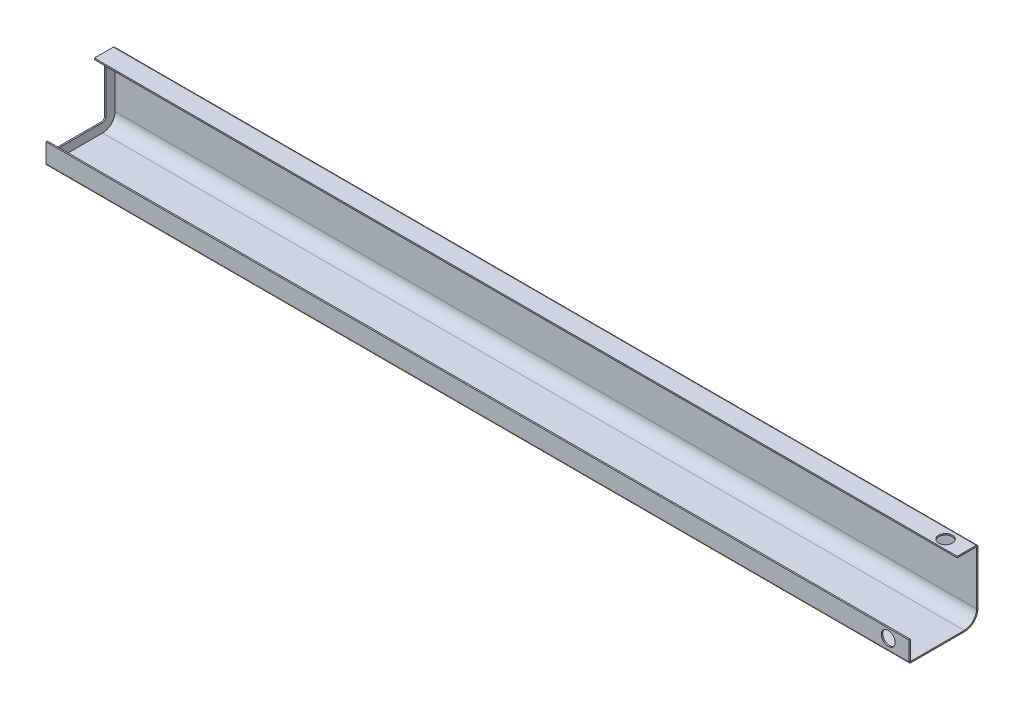
from build123d import *

# Parameters (mm, degrees)
SKETCH_2_W                       = 1250
SKETCH_2_H                       = 100
SM_BASE_FLANGE_1_DEPTH           = 2
SM_EDGE_FLANGE_1_STRIP_W         = 44
SM_EDGE_FLANGE_1_STRIP_H         = 2
SM_EDGE_FLANGE_1_STRIP_CUT_DEPTH = 1250
SM_EDGE_FLANGE_1_DEPTH           = 1250
SM_EDGE_FLANGE_2_STRIP_W         = 9.4732
SM_EDGE_FLANGE_2_STRIP_H         = 2
SM_EDGE_FLANGE_2_STRIP_CUT_DEPTH = 1250
SM_EDGE_FLANGE_2_DEPTH           = 1250
SM_EDGE_FLANGE_3_STRIP_W         = 9.4732
SM_EDGE_FLANGE_3_STRIP_H         = 2
SM_EDGE_FLANGE_3_STRIP_CUT_DEPTH = 1250
SM_EDGE_FLANGE_3_DEPTH           = 1250
SKETCH_16_R                      = 10
CUT_EXTRUDE_1_DEPTH              = 10
SKETCH_17_R                      = 10
CUT_EXTRUDE_2_DEPTH              = 10
EXTRUDE_1_DEPTH                  = 2


# Sheet-metal steps are written as plain solids
with BuildPart() as part:
    # Sketch 2 → 基体-法兰1 (new body)
    with BuildSketch(Plane.XY):
        Rectangle(SKETCH_2_W, SKETCH_2_H)
    extrude(amount=-SM_BASE_FLANGE_1_DEPTH)

    # 边线-法兰1 strip (across the edge) → 边线-法兰1 strip cut (cut)
    with BuildSketch(Plane(origin=(-625, -50, 0), x_dir=(0, 1, 0), z_dir=(1, 0, 0))):
        with Locations((-2, -1)):
            Rectangle(SM_EDGE_FLANGE_1_STRIP_W, SM_EDGE_FLANGE_1_STRIP_H)
    extrude(amount=SM_EDGE_FLANGE_1_STRIP_CUT_DEPTH, mode=Mode.SUBTRACT)

    # 边线-法兰1 section (across the edge) → 边线-法兰1 (add)
    with BuildSketch(Plane(origin=(-625, -50, 0), x_dir=(0, 1, 0), z_dir=(1, 0, 0))):
        with BuildLine():
            Line((0, 18), (0, 98))
            Line((0, 98), (2, 98))
            Line((2, 98), (2, 18))
            ThreePointArc((2, 18), (7.272077939, 5.272077939), (20, 0))
            Line((20, 0), (20, -2))
            ThreePointArc((20, -2), (5.857864376, 3.857864376), (0, 18))
        make_face()
    extrude(amount=SM_EDGE_FLANGE_1_DEPTH)

    # 边线-法兰2 strip (across the edge) → 边线-法兰2 strip cut (cut)
    with BuildSketch(Plane(origin=(625, 50, 0), x_dir=(0, -1, 0), z_dir=(-1, 0, 0))):
        with Locations((-2, -1)):
            Rectangle(SM_EDGE_FLANGE_2_STRIP_W, SM_EDGE_FLANGE_2_STRIP_H)
    extrude(amount=SM_EDGE_FLANGE_2_STRIP_CUT_DEPTH, mode=Mode.SUBTRACT)

    # 边线-法兰2 section (across the edge) → 边线-法兰2 (add)
    with BuildSketch(Plane(origin=(625, 50, 0), x_dir=(0, -1, 0), z_dir=(-1, 0, 0))):
        with BuildLine():
            Line((0, 0.7366), (0, 28))
            Line((0, 28), (2, 28))
            Line((2, 28), (2, 0.7366))
            ThreePointArc((2, 0.7366), (2.215745145, 0.215745145), (2.7366, 0))
            Line((2.7366, 0), (2.7366, -2))
            ThreePointArc((2.7366, -2), (0.801531583, -1.198468417), (0, 0.7366))
        make_face()
    extrude(amount=SM_EDGE_FLANGE_2_DEPTH)

    # 边线-法兰3 strip (across the edge) → 边线-法兰3 strip cut (cut)
    with BuildSketch(Plane(origin=(-625, -48, 98), x_dir=(0, 0, -1), z_dir=(1, 0, 0))):
        with Locations((-2, -1)):
            Rectangle(SM_EDGE_FLANGE_3_STRIP_W, SM_EDGE_FLANGE_3_STRIP_H)
    extrude(amount=SM_EDGE_FLANGE_3_STRIP_CUT_DEPTH, mode=Mode.SUBTRACT)

    # 边线-法兰3 section (across the edge) → 边线-法兰3 (add)
    with BuildSketch(Plane(origin=(-625, -48, 98), x_dir=(0, 0, -1), z_dir=(1, 0, 0))):
        with BuildLine():
            Line((0, 0.7366), (0, 28))
            Line((0, 28), (2, 28))
            Line((2, 28), (2, 0.7366))
            ThreePointArc((2, 0.7366), (2.215745145, 0.215745145), (2.7366, 0))
            Line((2.7366, 0), (2.7366, -2))
            ThreePointArc((2.7366, -2), (0.801531583, -1.198468417), (0, 0.7366))
        make_face()
    extrude(amount=SM_EDGE_FLANGE_3_DEPTH)

    # 草图16 → 切除-拉伸1 (cut)
    with BuildSketch(Plane(origin=(0, 50, 0), x_dir=(1, 0, 0), z_dir=(0, 1, 0))):
        with Locations(Location((595, -15, 0), (0, 0, 270))):
            Circle(SKETCH_16_R)
    extrude(amount=-CUT_EXTRUDE_1_DEPTH, mode=Mode.SUBTRACT)

    # 草图17 → 切除-拉伸2 (cut)
    with BuildSketch(Plane.XY.offset(98)):
        with Locations((595, -33)):
            Circle(SKETCH_17_R)
    extrude(amount=-CUT_EXTRUDE_2_DEPTH, mode=Mode.SUBTRACT)

    # 草图30 → 凸台-拉伸1 (add)
    with BuildSketch(Plane.ZY.offset(625)):
        with BuildLine():
            Line((13, 50), (0.7366, 50))
            ThreePointArc((0.7366, 50), (-1.198468417, 49.198468417), (-2, 47.2634))
            Line((-2, 47.2634), (-2, -30))
            ThreePointArc((-2, -30), (3.857864376, -44.142135624), (18, -50))
            Line((18, -50), (95.2634, -50))
            ThreePointArc((95.2634, -50), (97.198468417, -49.198468417), (98, -47.2634))
            Line((98, -47.2634), (98, -35))
            Line((98, -35), (18, -35))
            ThreePointArc((18, -35), (14.464466094, -33.535533906), (13, -30))
            Line((13, -30), (13, 50))
        make_face()
    extrude(amount=-EXTRUDE_1_DEPTH)


solid = part.part
